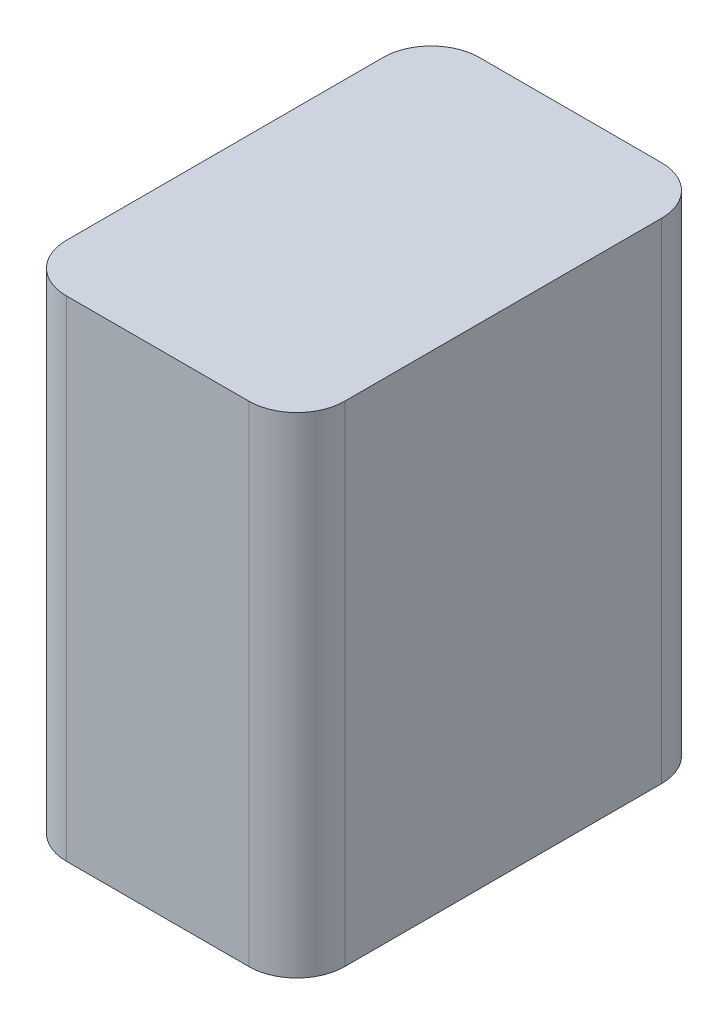
from build123d import *

# Parameters (mm, degrees)
SKETCH1_W           = 29
SKETCH1_H           = 43
BOSS_EXTRUDE1_DEPTH = 51
FILLET1_R           = 5


with BuildPart() as part:
    # Sketch1 → Boss-Extrude1 (new body)
    with BuildSketch(Plane(origin=(0, 0, 0), x_dir=(1, 0, 0), z_dir=(0, 1, 0))):
        with Locations((14.5, 21.5)):
            Rectangle(SKETCH1_W, SKETCH1_H)
    extrude(amount=BOSS_EXTRUDE1_DEPTH)

    # Fillet1
    fillet1_edges = [part.edges().sort_by_distance(p)[0] for p in [
        (0, 25.5, -43),
        (29, 25.5, -43),
        (0, 25.5, 0),
        (29, 25.5, 0),
    ]]
    fillet(fillet1_edges, radius=FILLET1_R)


solid = part.part
